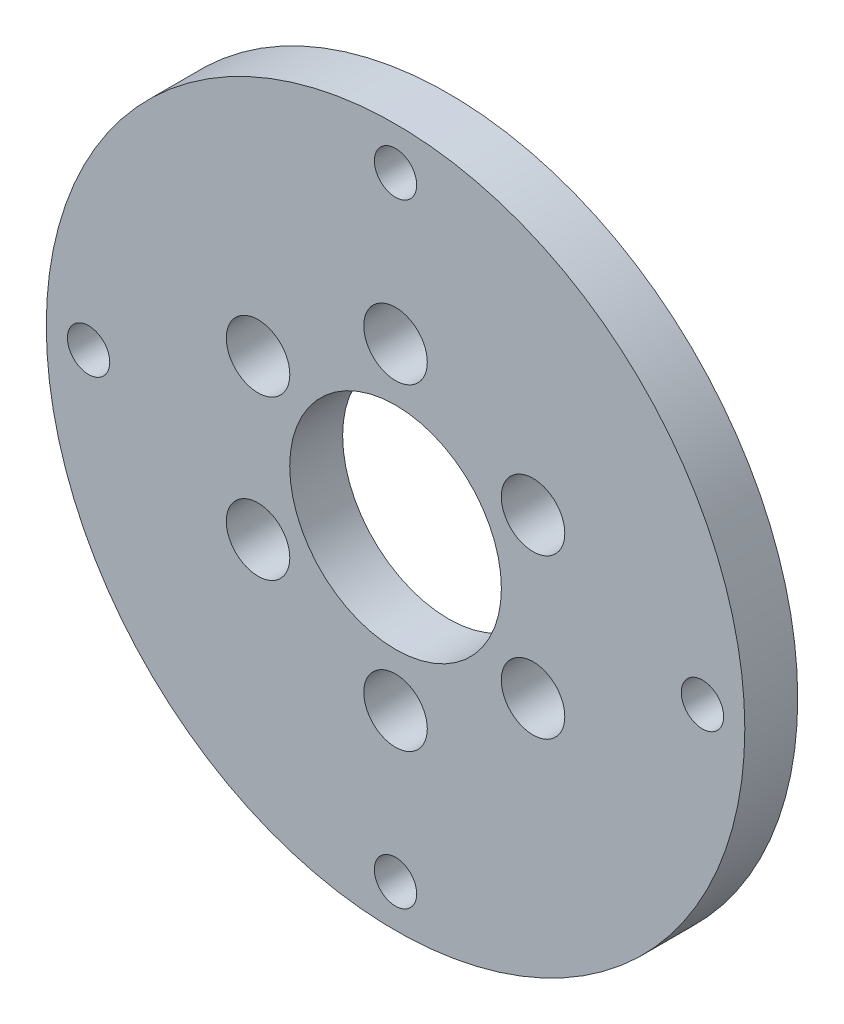
from build123d import *

# Parameters (mm, degrees)
SKETCH1_3_R         = 16.5
SKETCH1_3_R_2       = 1
SKETCH1_3_R_3       = 1.5
SKETCH1_3_R_4       = 5
BOSS_EXTRUDE2_DEPTH = 2.5


with BuildPart() as part:
    # Sketch1<3> → Boss-Extrude2 (new body)
    with BuildSketch(Plane.XY):
        Circle(SKETCH1_3_R)
        with Locations((-14.5, 0)):
            Circle(SKETCH1_3_R_2, mode=Mode.SUBTRACT)
        with Locations((0, -14.5)):
            Circle(SKETCH1_3_R_2, mode=Mode.SUBTRACT)
        with Locations((14.5, 0)):
            Circle(SKETCH1_3_R_2, mode=Mode.SUBTRACT)
        with Locations((0, 14.5)):
            Circle(SKETCH1_3_R_2, mode=Mode.SUBTRACT)
        with Locations((0, 7.5)):
            Circle(SKETCH1_3_R_3, mode=Mode.SUBTRACT)
        with Locations((-6.495190528, -3.75)):
            Circle(SKETCH1_3_R_3, mode=Mode.SUBTRACT)
        with Locations((0, -7.5)):
            Circle(SKETCH1_3_R_3, mode=Mode.SUBTRACT)
        with Locations((6.495190528, -3.75)):
            Circle(SKETCH1_3_R_3, mode=Mode.SUBTRACT)
        with Locations((-6.495190528, 3.75)):
            Circle(SKETCH1_3_R_3, mode=Mode.SUBTRACT)
        Circle(SKETCH1_3_R_4, mode=Mode.SUBTRACT)
        with Locations((6.495190528, 3.75)):
            Circle(SKETCH1_3_R_3, mode=Mode.SUBTRACT)
    extrude(amount=BOSS_EXTRUDE2_DEPTH)


solid = part.part
